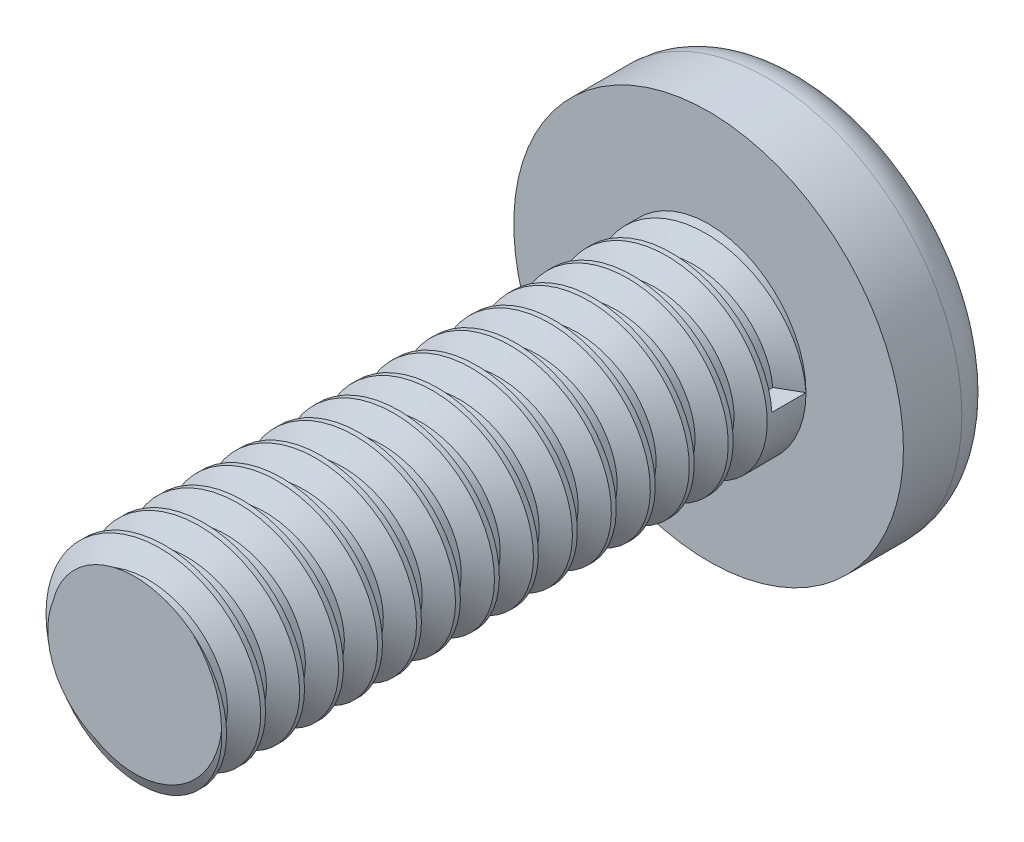
from build123d import *

# Parameters (mm, degrees)
SKIZZE1_R                       = 10
AUFSATZ_LINEAR_AUSTRAGEN1_DEPTH = 5
SKIZZE2_R                       = 5
AUFSATZ_LINEAR_AUSTRAGEN2_DEPTH = 30
GEWINDE1_PITCH                  = 2
VERRUNDUNG1_R                   = 2
SCHNITT_LINEAR_AUSTRAGEN1_DEPTH = 1


with BuildPart() as part:
    # Skizze1 → Aufsatz-Linear austragen1 (new body)
    with BuildSketch(Plane.XY):
        Circle(SKIZZE1_R)
    extrude(amount=AUFSATZ_LINEAR_AUSTRAGEN1_DEPTH)

    # Skizze2 → Aufsatz-Linear austragen2 (add)
    with BuildSketch(Plane.XY.offset(5)):
        Circle(SKIZZE2_R)
    extrude(amount=AUFSATZ_LINEAR_AUSTRAGEN2_DEPTH)

    # Gewinde1: the profile of Gewindeprofil1 profile screwed along a right-hand helix of 15 turns, 10 arcs to a turn; built about Z, then put on its axis
    gewinde1_z = Axis((0, 0, 0), (0, 0, 1))
    gewinde1_corners = [(5.0003, 0, -0.000173205), (5.0003, 0, 1.7501732), (3.91746825, 0, 1.124999997), (3.91746825, 0, 0.624999997)]
    with BuildLine(mode=Mode.PRIVATE) as gewinde1_profile:
        Line(gewinde1_corners[0], gewinde1_corners[1])
        Line(gewinde1_corners[1], gewinde1_corners[2])
        Line(gewinde1_corners[2], gewinde1_corners[3])
        Line(gewinde1_corners[3], gewinde1_corners[0])
    gewinde1_cap = Face(gewinde1_profile.wire())
    gewinde1_turn_angles = [0, 18, 36, 54, 72, 90, 108, 126, 144, 162, 180, 198, 216, 234, 252, 270, 288, 306, 324, 342, 360]
    gewinde1_turn_weights = [1, 0.9510565162951535, 1, 0.9510565162951535, 1, 0.9510565162951535, 1, 0.9510565162951535, 1, 0.9510565162951535, 1, 0.9510565162951535, 1, 0.9510565162951535, 1, 0.9510565162951535, 1, 0.9510565162951535, 1, 0.9510565162951535, 1]
    gewinde1_turn_rails = [Edge.make_bspline([Vector(p[0], p[1], 0).rotate(gewinde1_z, gewinde1_turn_angles[k]) / gewinde1_turn_weights[k] + Vector(0, 0, p[2] + GEWINDE1_PITCH * gewinde1_turn_angles[k] / 360) for k in range(21)], [0, 0, 0, 1, 1, 2, 2, 3, 3, 4, 4, 5, 5, 6, 6, 7, 7, 8, 8, 9, 9, 10, 10, 10], 2, gewinde1_turn_weights) for p in gewinde1_corners]
    gewinde1_turn_sides = [Face.make_surface_from_curves(gewinde1_turn_rails[p[0]], gewinde1_turn_rails[p[1]]) for p in [(0, 1), (1, 2), (2, 3), (3, 0)]]
    gewinde1 = Plane(origin=(0, 0, 5), x_dir=(1, 0, 0), z_dir=(0, 0, 1)) * Solid(Shell([*[p.moved(Location((0, 0, GEWINDE1_PITCH * i))) for i in range(15) for p in gewinde1_turn_sides], gewinde1_cap, gewinde1_cap.rotate(gewinde1_z, 5400).moved(Location((0, 0, GEWINDE1_PITCH * 5400 / 360)))]))
    add(gewinde1, mode=Mode.SUBTRACT)

    # Verrundung1
    verrundung1_edges = [part.edges().sort_by_distance(p)[0] for p in [
        (-10, 0, 0),
    ]]
    fillet(verrundung1_edges, radius=VERRUNDUNG1_R)

    # Skizze5 → Schnitt-Linear austragen1 (cut)
    with BuildSketch(Plane(origin=(0, 0, 0), x_dir=(-1, 0, 0), z_dir=(0, 0, -1))):
        Polygon((-3.537900669, 3.568369215), (-0.06734242, 0.703892746), (2.797134048, 4.174450996), (3.568369215, 3.537900669), (0.703892746, 0.06734242), (4.174450996, -2.797134048), (3.537900669, -3.568369215), (0.06734242, -0.703892746), (-2.797134048, -4.174450996), (-3.568369215, -3.537900669), (-0.703892746, -0.06734242), (-4.174450996, 2.797134048), align=None)
    extrude(amount=-SCHNITT_LINEAR_AUSTRAGEN1_DEPTH, mode=Mode.SUBTRACT)


solid = part.part
